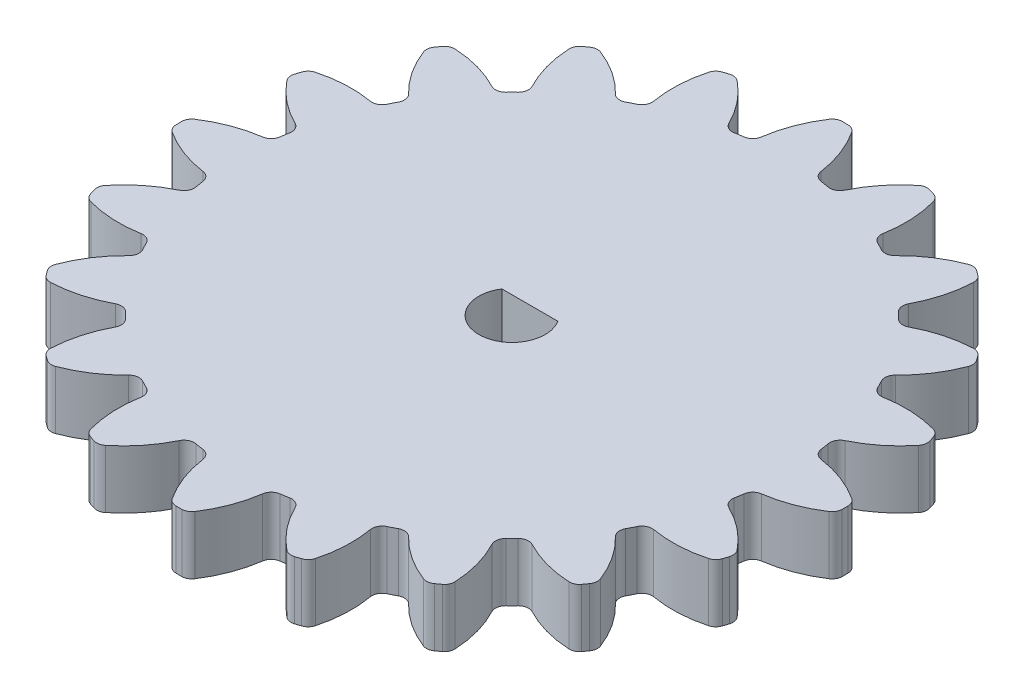
from build123d import *

# Parameters (mm, degrees)
SKETCH1_R                = 13.375
BASE_FLANGE2_DEPTH       = 2.85
TAB1_START               = -2.85
TAB1_DEPTH               = 2.85
FILLET1_R                = 0.5
CIRPATTERN1_COUNT        = 20
FILLET1_OF_CIRPATTERN1_R = 0.5
CUT_EXTRUDE1_DEPTH       = 24.227193268


# Read off the part's stored shape, not the designer's step: Tab1
# Sheet-metal steps are written as plain solids
with BuildPart() as part:
    # Sketch1 → Base-Flange2 (new body)
    with BuildSketch(Plane(origin=(0, 0, 0), x_dir=(1, 0, 0), z_dir=(0, 1, 0))):
        with Locations(Location((0, 0, 0), (0, 0, 270))):
            Circle(SKETCH1_R)
    extrude(amount=-BASE_FLANGE2_DEPTH)

    # Tab1 outline → Tab1 (add)
    with BuildSketch(Plane(origin=(0, 0, 0), x_dir=(1, 0, 0), z_dir=(0, 1, 0)).offset(TAB1_START)):
        with BuildLine():
            ThreePointArc((0.4, 16.295091285), (0, 16.3), (-0.4, 16.295091285))
            ThreePointArc((-0.4, 16.295091285), (-1.158266779, 14.869107372), (-1.5, 13.290621694))
            ThreePointArc((-1.5, 13.290621694), (0, 13.375), (1.5, 13.290621694))
            ThreePointArc((1.5, 13.290621694), (1.158266779, 14.869107372), (0.4, 16.295091285))
        make_face()
    tab1 = extrude(amount=TAB1_DEPTH)

    # Fillet1
    fillet1_edges = [part.edges().sort_by_distance(p)[0] for p in [
        (-1.5, -1.425, -13.290621694),
        (-0.4, -1.425, -16.295091285),
        (0.4, -1.425, -16.295091285),
        (1.5, -1.425, -13.290621694),
    ]]
    fillet(fillet1_edges, radius=FILLET1_R)

    # CirPattern1: Tab1 ×20 about axis
    cirpattern1_axis = Axis((0, 0, 0), (0, 1, 0))
    for i in range(1, CIRPATTERN1_COUNT):
        add(tab1.rotate(cirpattern1_axis, i * 360 / CIRPATTERN1_COUNT))

    # Fillet1 of CirPattern1
    fillet1_of_cirpattern1_edges = [part.edges().sort_by_distance(p)[0] for p in [
        (-5.533612744, -1.425, -12.176606876),
        (-5.415882738, -1.425, -15.373945952),
        (-4.655037525, -1.425, -15.621159548),
        (-2.680443195, -1.425, -13.103657859),
        (-9.025556917, -1.425, -9.870660938),
        (-9.90162114, -1.425, -12.947891674),
        (-9.254407544, -1.425, -13.418119875),
        (-6.598505934, -1.425, -11.634016695),
        (-11.634016695, -1.425, -6.598505934),
        (-13.418119875, -1.425, -9.254407544),
        (-12.947891674, -1.425, -9.90162114),
        (-9.870660938, -1.425, -9.025556917),
        (-13.103657859, -1.425, -2.680443195),
        (-15.621159548, -1.425, -4.655037525),
        (-15.373945952, -1.425, -5.415882738),
        (-12.176606876, -1.425, -5.533612744),
        (-13.290621694, -1.425, 1.5),
        (-16.295091285, -1.425, 0.4),
        (-16.295091285, -1.425, -0.4),
        (-13.290621694, -1.425, -1.5),
        (-12.176606876, -1.425, 5.533612744),
        (-15.373945952, -1.425, 5.415882738),
        (-15.621159548, -1.425, 4.655037525),
        (-13.103657859, -1.425, 2.680443195),
        (-9.870660938, -1.425, 9.025556917),
        (-12.947891674, -1.425, 9.90162114),
        (-13.418119875, -1.425, 9.254407544),
        (-11.634016695, -1.425, 6.598505934),
        (-6.598505934, -1.425, 11.634016695),
        (-9.254407544, -1.425, 13.418119875),
        (-9.90162114, -1.425, 12.947891674),
        (-9.025556917, -1.425, 9.870660938),
        (-2.680443195, -1.425, 13.103657859),
        (-4.655037525, -1.425, 15.621159548),
        (-5.415882738, -1.425, 15.373945952),
        (-5.533612744, -1.425, 12.176606876),
        (1.5, -1.425, 13.290621694),
        (0.4, -1.425, 16.295091285),
        (-0.4, -1.425, 16.295091285),
        (-1.5, -1.425, 13.290621694),
        (5.533612744, -1.425, 12.176606876),
        (5.415882738, -1.425, 15.373945952),
        (4.655037525, -1.425, 15.621159548),
        (2.680443195, -1.425, 13.103657859),
        (9.025556917, -1.425, 9.870660938),
        (9.90162114, -1.425, 12.947891674),
        (9.254407544, -1.425, 13.418119875),
        (6.598505934, -1.425, 11.634016695),
        (11.634016695, -1.425, 6.598505934),
        (13.418119875, -1.425, 9.254407544),
        (12.947891674, -1.425, 9.90162114),
        (9.870660938, -1.425, 9.025556917),
        (13.103657859, -1.425, 2.680443195),
        (15.621159548, -1.425, 4.655037525),
        (15.373945952, -1.425, 5.415882738),
        (12.176606876, -1.425, 5.533612744),
        (13.290621694, -1.425, -1.5),
        (16.295091285, -1.425, -0.4),
        (16.295091285, -1.425, 0.4),
        (13.290621694, -1.425, 1.5),
        (12.176606876, -1.425, -5.533612744),
        (15.373945952, -1.425, -5.415882738),
        (15.621159548, -1.425, -4.655037525),
        (13.103657859, -1.425, -2.680443195),
        (9.870660938, -1.425, -9.025556917),
        (12.947891674, -1.425, -9.90162114),
        (13.418119875, -1.425, -9.254407544),
        (11.634016695, -1.425, -6.598505934),
        (6.598505934, -1.425, -11.634016695),
        (9.254407544, -1.425, -13.418119875),
        (9.90162114, -1.425, -12.947891674),
        (9.025556917, -1.425, -9.870660938),
        (2.680443195, -1.425, -13.103657859),
        (4.655037525, -1.425, -15.621159548),
        (5.415882738, -1.425, -15.373945952),
        (5.533612744, -1.425, -12.176606876),
    ]]
    fillet(fillet1_of_cirpattern1_edges, radius=FILLET1_OF_CIRPATTERN1_R)

    # Sketch11 → Cut-Extrude1 (cut, through all)
    with BuildSketch(Plane(origin=(0, 0, 0), x_dir=(1, 0, 0), z_dir=(0, 1, 0))):
        with BuildLine():
            Line((-1.369306394, 0.875), (1.369306394, 0.875))
            ThreePointArc((1.369306394, 0.875), (0, -1.625), (-1.369306394, 0.875))
        make_face()
    extrude(amount=-CUT_EXTRUDE1_DEPTH, mode=Mode.SUBTRACT)


solid = part.part
